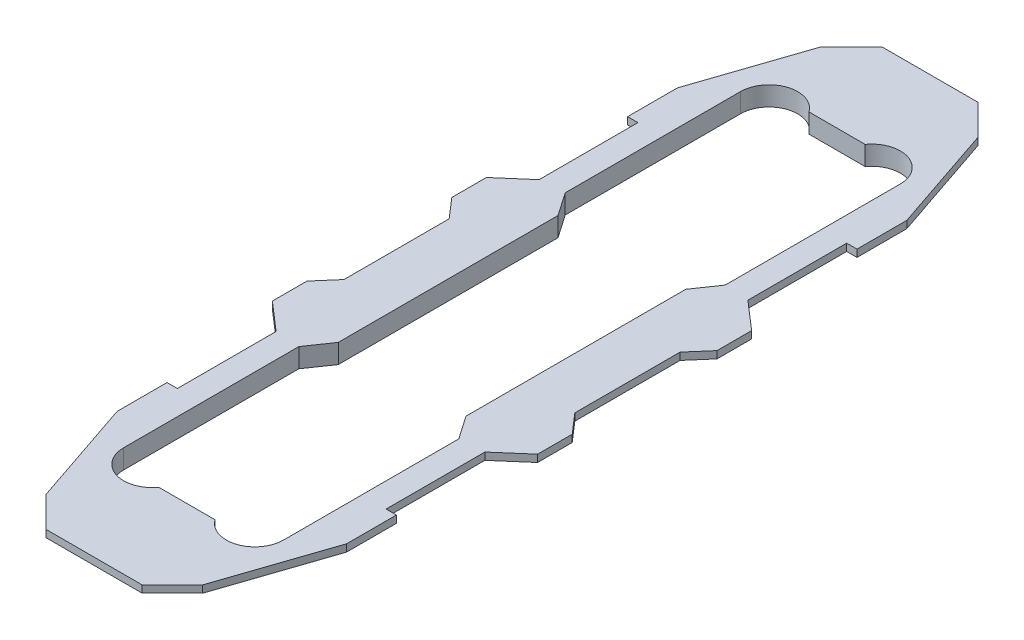
from build123d import *

# Parameters (mm, degrees)
BOSS_EXTRUDE1_DEPTH = 2.5
BOSS_EXTRUDE3_DEPTH = 1.5


# Read off the part's stored shape, not the designer's step: Boss-Extrude1
with BuildPart() as part:
    # Boss-Extrude1 outline → Boss-Extrude1 (new body)
    with BuildSketch(Plane(origin=(0, 0, 0), x_dir=(1, 0, 0), z_dir=(0, 1, 0))):
        with BuildLine():
            ThreePointArc((17.600819084, 64.048530094), (13.028302904, 70.558621532), (5.345717729, 68.492930418))
            Line((5.345717729, 68.492930418), (-5.345717729, 68.492930418))
            ThreePointArc((-5.345717729, 68.492930418), (-13.028302904, 70.558621532), (-17.600819084, 64.048530094))
            Line((-17.600819084, 64.048530094), (-17.600819084, 27.344801488))
            Line((-17.600819084, 27.344801488), (-14.264554689, 22.498047837))
            Line((-14.264554689, 22.498047837), (-14.264554689, -22.498047837))
            Line((-14.264554689, -22.498047837), (-17.600819084, -27.344801488))
            Line((-17.600819084, -27.344801488), (-17.600819084, -64.048530094))
            ThreePointArc((-17.600819084, -64.048530094), (-13.028302904, -70.558621532), (-5.345717729, -68.492930418))
            Line((-5.345717729, -68.492930418), (5.345717729, -68.492930418))
            ThreePointArc((5.345717729, -68.492930418), (13.028302904, -70.558621532), (17.600819084, -64.048530094))
            Line((17.600819084, -64.048530094), (17.600819084, -27.344801488))
            Line((17.600819084, -27.344801488), (14.264554689, -22.498047837))
            Line((14.264554689, -22.498047837), (14.264554689, 22.498047837))
            Line((14.264554689, 22.498047837), (17.600819084, 27.344801488))
            Line((17.600819084, 27.344801488), (17.600819084, 64.048530094))
        make_face()
        with BuildLine():
            Line((16.600819084, -27.655707745), (16.600819084, -64.025237528))
            ThreePointArc((16.600819084, -64.025237528), (12.483449957, -69.688325839), (5.834875923, -67.492930418))
            Line((5.834875923, -67.492930418), (-5.834875923, -67.492930418))
            ThreePointArc((-5.834875923, -67.492930418), (-12.483449957, -69.688325839), (-16.600819084, -64.025237528))
            Line((-16.600819084, -64.025237528), (-16.600819084, -27.655707745))
            Line((-16.600819084, -27.655707745), (-13.264554689, -22.808954094))
            Line((-13.264554689, -22.808954094), (-13.264554689, 22.808954094))
            Line((-13.264554689, 22.808954094), (-16.600819084, 27.655707745))
            Line((-16.600819084, 27.655707745), (-16.600819084, 64.025237528))
            ThreePointArc((-16.600819084, 64.025237528), (-12.483449957, 69.688325839), (-5.834875923, 67.492930418))
            Line((-5.834875923, 67.492930418), (5.834875923, 67.492930418))
            ThreePointArc((5.834875923, 67.492930418), (12.483449957, 69.688325839), (16.600819084, 64.025237528))
            Line((16.600819084, 64.025237528), (16.600819084, 27.655707745))
            Line((16.600819084, 27.655707745), (13.264554689, 22.808954094))
            Line((13.264554689, 22.808954094), (13.264554689, -22.808954094))
            Line((13.264554689, -22.808954094), (16.600819084, -27.655707745))
        make_face(mode=Mode.SUBTRACT)
    extrude(amount=BOSS_EXTRUDE1_DEPTH)

    # Sketch4 → Boss-Extrude3 (add)
    with BuildSketch(Plane(origin=(0, 2.5, 0), x_dir=(1, 0, 0), z_dir=(0, 1, 0))):
        Polygon((-9.982037134, 86.769350006), (9.982037134, 86.769350006), (16.264456892, 80.486930248), (23.81578312, 58.16008483), (23.81578312, 47.812822946), (21.672882272, 47.812822946), (21.672882272, 27.300144084), (27.53346101, 22.216178317), (27.53346101, 15.033319747), (23.968939697, 10.924291721), (23.968939697, -10.924291721), (27.53346101, -15.033319747), (27.53346101, -22.216178317), (21.672882272, -27.300144084), (21.672882272, -47.812822946), (23.81578312, -47.812822946), (23.81578312, -58.16008483), (16.264456892, -80.486930248), (9.982037134, -86.769350006), (-9.982037134, -86.769350006), (-16.264456892, -80.486930248), (-23.81578312, -58.16008483), (-23.81578312, -47.812822946), (-21.672882272, -47.812822946), (-21.672882272, -27.300144084), (-27.53346101, -22.216178317), (-27.53346101, -15.033319747), (-23.968939697, -10.924291721), (-23.968939697, 10.924291721), (-27.53346101, 15.033319747), (-27.53346101, 22.216178317), (-21.672882272, 27.300144084), (-21.672882272, 47.812822946), (-23.81578312, 47.812822946), (-23.81578312, 58.16008483), (-16.264456892, 80.486930248), align=None)
        with BuildLine():
            Line((13.264554689, 22.808954094), (13.264554689, -22.808954094))
            Line((13.264554689, -22.808954094), (16.600819084, -27.655707745))
            Line((16.600819084, -27.655707745), (16.600819084, -64.025237528))
            ThreePointArc((16.600819084, -64.025237528), (12.483449957, -69.688325839), (5.834875923, -67.492930418))
            Line((5.834875923, -67.492930418), (-5.834875923, -67.492930418))
            ThreePointArc((-5.834875923, -67.492930418), (-12.483449957, -69.688325839), (-16.600819084, -64.025237528))
            Line((-16.600819084, -64.025237528), (-16.600819084, -27.655707745))
            Line((-16.600819084, -27.655707745), (-13.264554689, -22.808954094))
            Line((-13.264554689, -22.808954094), (-13.264554689, 22.808954094))
            Line((-13.264554689, 22.808954094), (-16.600819084, 27.655707745))
            Line((-16.600819084, 27.655707745), (-16.600819084, 64.025237528))
            ThreePointArc((-16.600819084, 64.025237528), (-12.483449957, 69.688325839), (-5.834875923, 67.492930418))
            Line((-5.834875923, 67.492930418), (5.834875923, 67.492930418))
            ThreePointArc((5.834875923, 67.492930418), (12.483449957, 69.688325839), (16.600819084, 64.025237528))
            Line((16.600819084, 64.025237528), (16.600819084, 27.655707745))
            Line((16.600819084, 27.655707745), (13.264554689, 22.808954094))
        make_face(mode=Mode.SUBTRACT)
    extrude(amount=BOSS_EXTRUDE3_DEPTH)


solid = part.part
